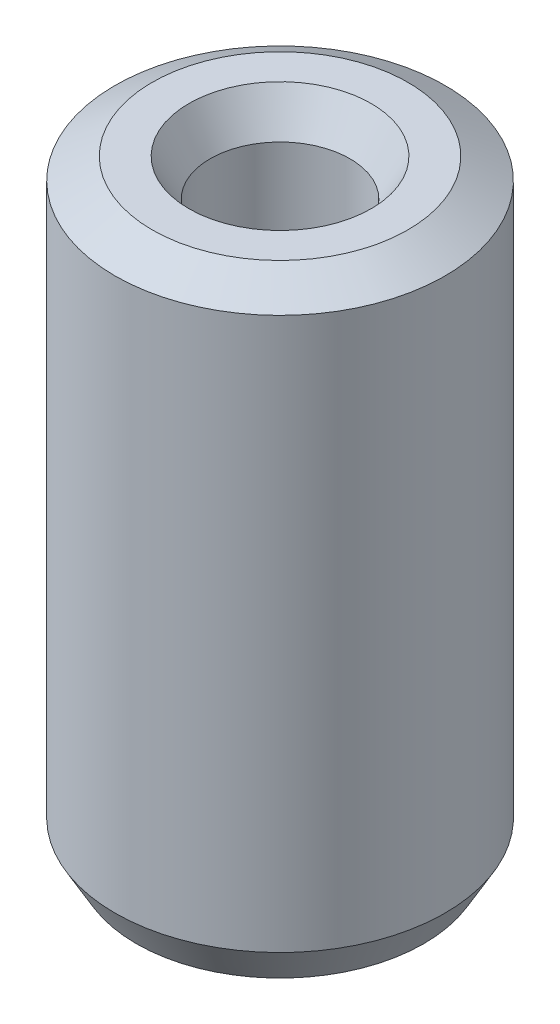
from build123d import *
from OCP.BRepFilletAPI import BRepFilletAPI_MakeChamfer

# Parameters (mm, degrees)
SKETCH1_R           = 5
BOSS_EXTRUDE1_DEPTH = 18.490599314
SKETCH2_R           = 2.117865235
CUT_EXTRUDE1_DEPTH  = 20.796521487
CHAMFER1_SIZE       = 0.644435604
CHAMFER1_SIZE2      = 1.126382545


with BuildPart() as part:
    # Sketch1 → Boss-Extrude1 (new body)
    with BuildSketch(Plane(origin=(0, 0, 0), x_dir=(1, 0, 0), z_dir=(0, 1, 0))):
        Circle(SKETCH1_R)
    extrude(amount=BOSS_EXTRUDE1_DEPTH)

    # Sketch2 → Cut-Extrude1 (cut, through all)
    with BuildSketch(Plane(origin=(0, 0, 0), x_dir=(1, 0, 0), z_dir=(0, 1, 0))):
        Circle(SKETCH2_R)
    extrude(amount=CUT_EXTRUDE1_DEPTH, mode=Mode.SUBTRACT)

    # Chamfer1: one chamfer whose edges measure the first distance from different faces: ONE call of the kernel's chamfer builder (chamfer() names one face for all edges)
    chamfer1_edges_1 = [part.edges().sort_by_distance(p)[0] for p in [
        (-2.117865235, 18.490599314, 0),
    ]]
    chamfer1_side_1 = [part.faces().sort_by_distance(p)[0] for p in [
        (-4.858578644, 18.490599314, 0),
    ]]
    chamfer1_edges_2 = [part.edges().sort_by_distance(p)[0] for p in [
        (-2.117865235, 0, 0),
    ]]
    chamfer1_side_2 = [part.faces().sort_by_distance(p)[0] for p in [
        (-2.117865235, 9.245299657, 0),
    ]]
    chamfer1_edges_3 = [part.edges().sort_by_distance(p)[0] for p in [
        (-5, 0, 0),
    ]]
    chamfer1_side_3 = [part.faces().sort_by_distance(p)[0] for p in [
        (-4.858578644, 0, 0),
    ]]
    chamfer1_edges_4 = [part.edges().sort_by_distance(p)[0] for p in [
        (-5, 18.490599314, 0),
    ]]
    chamfer1_side_4 = [part.faces().sort_by_distance(p)[0] for p in [
        (-5, 9.245299657, 0),
    ]]
    chamfer1 = BRepFilletAPI_MakeChamfer(part.part.solid().wrapped)
    for e in chamfer1_edges_1:
        chamfer1.Add(CHAMFER1_SIZE, CHAMFER1_SIZE2, e.wrapped, chamfer1_side_1[0].wrapped)  # the first distance lies on this face
    for e in chamfer1_edges_2:
        chamfer1.Add(CHAMFER1_SIZE, CHAMFER1_SIZE2, e.wrapped, chamfer1_side_2[0].wrapped)  # the first distance lies on this face
    for e in chamfer1_edges_3:
        chamfer1.Add(CHAMFER1_SIZE, CHAMFER1_SIZE2, e.wrapped, chamfer1_side_3[0].wrapped)  # the first distance lies on this face
    for e in chamfer1_edges_4:
        chamfer1.Add(CHAMFER1_SIZE, CHAMFER1_SIZE2, e.wrapped, chamfer1_side_4[0].wrapped)  # the first distance lies on this face
    add(Compound.cast(chamfer1.Shape()), mode=Mode.REPLACE)


solid = part.part
